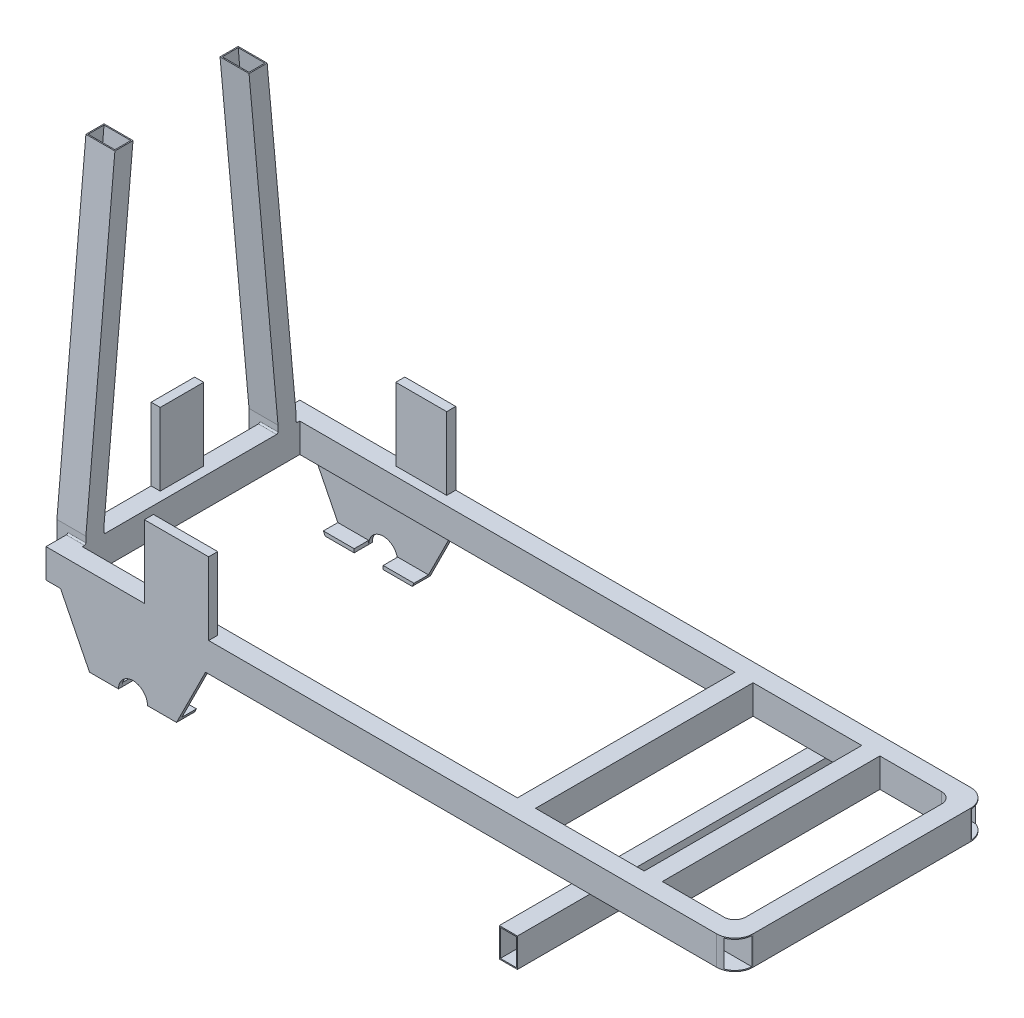
from build123d import *

# Parameters (mm, degrees)
SKETCH1_W            = 25
SKETCH1_H            = 40
SKETCH1_W_2          = 22
SKETCH1_H_2          = 37
BOSS_EXTRUDE1_DEPTH  = 950
SKETCH3_W            = 25
SKETCH3_H            = 40
SKETCH3_W_2          = 22
SKETCH3_H_2          = 37
BOSS_EXTRUDE2_DEPTH  = 950
SKETCH4_W            = 25
SKETCH4_H            = 40
SKETCH4_W_2          = 22
SKETCH4_H_2          = 37
BOSS_EXTRUDE3_DEPTH  = 300
SKETCH5_W            = 25
SKETCH5_H            = 40
SKETCH5_W_2          = 22
SKETCH5_H_2          = 37
BOSS_EXTRUDE4_DEPTH  = 300
CUT_EXTRUDE1_DEPTH   = 300
CUT_EXTRUDE2_DEPTH   = 300
BOSS_EXTRUDE5_DEPTH  = 40
BOSS_EXTRUDE6_DEPTH  = 40
SKETCH10_W           = 25
SKETCH10_H           = 300
BOSS_EXTRUDE7_DEPTH  = 40
SKETCH12_W           = 25
SKETCH12_H           = 40
SKETCH12_W_2         = 22
SKETCH12_H_2         = 37
BOSS_EXTRUDE8_DEPTH  = 100
SKETCH14_W           = 25
SKETCH14_H           = 40
SKETCH14_W_2         = 22
SKETCH14_H_2         = 37
BOSS_EXTRUDE9_DEPTH  = 350
SKETCH15_W           = 25
SKETCH15_H           = 40
SKETCH15_W_2         = 22
SKETCH15_H_2         = 37
BOSS_EXTRUDE10_DEPTH = 300
BOSS_EXTRUDE11_DEPTH = 5
BOSS_EXTRUDE12_DEPTH = 20
SKETCH19_R           = 20
CUT_EXTRUDE3_DEPTH   = 20
SKETCH21_W           = 12.5
SKETCH21_H           = 60.024303072
SKETCH21_W_2         = 70.240967534
SKETCH21_H_2         = 12.5
SKETCH21_W_3         = 88.627521068
BOSS_EXTRUDE13_DEPTH = 100
BOSS_EXTRUDE14_DEPTH = 10
FILLET1_R            = 2
FILLET2_R            = 2
FILLET3_R            = 2
FILLET4_R            = 2
BOSS_EXTRUDE15_DEPTH = 40
BOSS_EXTRUDE16_DEPTH = 40
SWEEP1_START         = -14.984844988
SWEEP1_DEPTH         = 39.984844988
SWEEP1_2_DEPTH       = 1.5
SWEEP1_START_2       = 23.5
SWEEP1_3_DEPTH       = 1.5
SWEEP2_START         = -14.984844988
SWEEP2_DEPTH         = 39.984844988
SWEEP2_2_DEPTH       = 1.5
SWEEP2_START_2       = 23.5
SWEEP2_3_DEPTH       = 1.5


# Read off the part's stored shape, not the designer's step: Sweep1, Sweep2
with BuildPart() as part:
    # Sketch1 → Boss-Extrude1 (new body)
    with BuildSketch(Plane(origin=(0, 0, 0), x_dir=(0, 0, -1), z_dir=(1, 0, 0))):
        with Locations((12.5, -20)):
            Rectangle(SKETCH1_W, SKETCH1_H)
        with Locations((12.5, -20)):
            Rectangle(SKETCH1_W_2, SKETCH1_H_2, mode=Mode.SUBTRACT)
    extrude(amount=BOSS_EXTRUDE1_DEPTH)



with BuildPart() as body_2:
    # Sketch3 → Boss-Extrude2 (new body)
    with BuildSketch(Plane(origin=(950, 0, 0), x_dir=(0, 0, -1), z_dir=(1, 0, 0))):
        with Locations((337.5, -20)):
            Rectangle(SKETCH3_W, SKETCH3_H)
        with Locations((337.5, -20)):
            Rectangle(SKETCH3_W_2, SKETCH3_H_2, mode=Mode.SUBTRACT)
    extrude(amount=-BOSS_EXTRUDE2_DEPTH)


with BuildPart() as part_1:
    add(part.part)

    add(body_2.part)  # Boss-Extrude3 merges body 2
    # Sketch4 → Boss-Extrude3 (add)
    with BuildSketch(Plane.XY.offset(-325)):
        with Locations((937.5, -20)):
            Rectangle(SKETCH4_W, SKETCH4_H)
        with Locations((937.5, -20)):
            Rectangle(SKETCH4_W_2, SKETCH4_H_2, mode=Mode.SUBTRACT)
    extrude(amount=BOSS_EXTRUDE3_DEPTH)

    # Sketch5 → Boss-Extrude4 (add)
    with BuildSketch(Plane.XY.offset(-325)):
        with Locations((12.5, -20)):
            Rectangle(SKETCH5_W, SKETCH5_H)
        with Locations((12.5, -20)):
            Rectangle(SKETCH5_W_2, SKETCH5_H_2, mode=Mode.SUBTRACT)
    extrude(amount=BOSS_EXTRUDE4_DEPTH)

    # Sketch6 → Cut-Extrude1 (cut)
    with BuildSketch(Plane(origin=(0, 0, 0), x_dir=(1, 0, 0), z_dir=(0, 1, 0))):
        with BuildLine():
            Line((925, 0), (950, 0))
            Line((950, 0), (950, 25))
            ThreePointArc((950, 25), (942.67766953, 7.32233047), (925, 0))
        make_face()
    extrude(amount=-CUT_EXTRUDE1_DEPTH, mode=Mode.SUBTRACT)

    # Sketch7 → Cut-Extrude2 (cut)
    with BuildSketch(Plane(origin=(0, 0, 0), x_dir=(1, 0, 0), z_dir=(0, 1, 0))):
        with BuildLine():
            Line((950, 325), (950, 350))
            Line((950, 350), (925, 350))
            ThreePointArc((925, 350), (942.67766953, 342.67766953), (950, 325))
        make_face()
    extrude(amount=-CUT_EXTRUDE2_DEPTH, mode=Mode.SUBTRACT)

    # Sketch8 → Boss-Extrude5 (add)
    with BuildSketch(Plane(origin=(0, 0, 0), x_dir=(1, 0, 0), z_dir=(0, 1, 0))):
        with BuildLine():
            Line((910, 25), (925, 25))
            Line((925, 25), (925, 40))
            ThreePointArc((925, 40), (920.606601718, 29.393398282), (910, 25))
        make_face()
    extrude(amount=-BOSS_EXTRUDE5_DEPTH)

    # Sketch9 → Boss-Extrude6 (add)
    with BuildSketch(Plane(origin=(0, 0, 0), x_dir=(1, 0, 0), z_dir=(0, 1, 0))):
        with BuildLine():
            Line((925, 310), (925, 325))
            Line((925, 325), (910, 325))
            ThreePointArc((910, 325), (920.606601718, 320.606601718), (925, 310))
        make_face()
    extrude(amount=-BOSS_EXTRUDE6_DEPTH)

    # Sketch10 → Boss-Extrude7 (add)
    with BuildSketch(Plane(origin=(0, 0, 0), x_dir=(1, 0, 0), z_dir=(0, 1, 0))):
        with Locations((812.5, 175)):
            Rectangle(SKETCH10_W, SKETCH10_H)
    extrude(amount=-BOSS_EXTRUDE7_DEPTH)



with BuildPart() as body_2_2:
    # Sketch12 → Boss-Extrude8 (new body)
    with BuildSketch(Plane.XY):
        with Locations((737.631643114, -60)):
            Rectangle(SKETCH12_W, SKETCH12_H)
        with Locations((737.631643114, -60)):
            Rectangle(SKETCH12_W_2, SKETCH12_H_2, mode=Mode.SUBTRACT)
    extrude(amount=BOSS_EXTRUDE8_DEPTH)


with BuildPart() as part_2:
    add(part_1.part)

    add(body_2_2.part)  # Boss-Extrude9 merges body 2 2
    # Sketch14 → Boss-Extrude9 (add)
    with BuildSketch(Plane(origin=(0, 0, 0), x_dir=(-1, 0, 0), z_dir=(0, 0, -1))):
        with Locations((-737.631643114, -60)):
            Rectangle(SKETCH14_W, SKETCH14_H)
        with Locations((-737.631643114, -60)):
            Rectangle(SKETCH14_W_2, SKETCH14_H_2, mode=Mode.SUBTRACT)
    extrude(amount=BOSS_EXTRUDE9_DEPTH)

    # Sketch15 → Boss-Extrude10 (add)
    with BuildSketch(Plane.XY.offset(-325)):
        with Locations((637.631643114, -20)):
            Rectangle(SKETCH15_W, SKETCH15_H)
        with Locations((637.631643114, -20)):
            Rectangle(SKETCH15_W_2, SKETCH15_H_2, mode=Mode.SUBTRACT)
    extrude(amount=BOSS_EXTRUDE10_DEPTH)

    # Sketch16 → Boss-Extrude11 (add)
    with BuildSketch(Plane(origin=(0, 0, -350), x_dir=(-1, 0, 0), z_dir=(0, 0, -1))):
        Polygon((-20, -40), (-220, -40), (-180, -120), (-60, -120), align=None)
    boss_extrude11 = extrude(amount=-BOSS_EXTRUDE11_DEPTH)

    # Mirror1: Boss-Extrude11 across plane
    add(boss_extrude11.mirror(Plane.XY.offset(-175)))

    # Sketch18 → Boss-Extrude12 (add)
    with BuildSketch(Plane.XY.offset(-345)):
        Polygon((60, -115), (57.5, -115), (60, -120), (100, -120), (100, -115), align=None)
        Polygon((180, -115), (182.5, -115), (180, -120), (140, -120), (140, -115), align=None)
    boss_extrude12 = extrude(amount=BOSS_EXTRUDE12_DEPTH)

    # Sketch19 → Cut-Extrude3 (cut)
    with BuildSketch(Plane.XY.offset(-345)):
        with Locations((120, -120)):
            Circle(SKETCH19_R)
    cut_extrude3 = extrude(amount=-CUT_EXTRUDE3_DEPTH, mode=Mode.SUBTRACT)

    # Mirror2: Boss-Extrude12, Cut-Extrude3 across plane
    add(boss_extrude12.mirror(Plane.XY.offset(-175)))
    add(cut_extrude3.mirror(Plane.XY.offset(-175)), mode=Mode.SUBTRACT)

    # Sketch21 → Boss-Extrude13 (add)
    with BuildSketch(Plane(origin=(0, 0, 0), x_dir=(1, 0, 0), z_dir=(0, 1, 0))):
        with Locations((6.25, 175)):
            Rectangle(SKETCH21_W, SKETCH21_H)
        with Locations((180, 343.75)):
            Rectangle(SKETCH21_W_2, SKETCH21_H_2)
        with Locations((180, 6.25)):
            Rectangle(SKETCH21_W_3, SKETCH21_H_2)
    extrude(amount=BOSS_EXTRUDE13_DEPTH)

    # Sketch22 → Boss-Extrude14 (add)
    with BuildSketch(Plane(origin=(0, 0, 0), x_dir=(1, 0, 0), z_dir=(0, 1, 0))):
        Polygon((0, 320), (25, 320), (25, 295), (0, 295), (-14.984844988, 295), (-14.984844988, 320), align=None)
        Polygon((0, 318.5), (-13.484844988, 318.5), (-13.484844988, 296.5), (0, 296.5), (23.5, 296.5), (23.5, 318.5), align=None, mode=Mode.SUBTRACT)
    boss_extrude14 = extrude(amount=BOSS_EXTRUDE14_DEPTH)

    # Mirror3: Boss-Extrude14 across plane
    add(boss_extrude14.mirror(Plane.XY.offset(-175)))

    # Fillet1
    fillet1_edges = [part_2.edges().sort_by_distance(p)[0] for p in [
        (12.5, 0, -55),
    ]]
    fillet(fillet1_edges, radius=FILLET1_R)

    # Fillet2
    fillet2_edges = [part_2.edges().sort_by_distance(p)[0] for p in [
        (12.5, 0, -295),
    ]]
    fillet(fillet2_edges, radius=FILLET2_R)

    # Fillet3
    fillet3_edges = [part_2.edges().sort_by_distance(p)[0] for p in [
        (12.5, 0, -320),
    ]]
    fillet(fillet3_edges, radius=FILLET3_R)

    # Fillet4
    fillet4_edges = [part_2.edges().sort_by_distance(p)[0] for p in [
        (12.5, 0, -30),
    ]]
    fillet(fillet4_edges, radius=FILLET4_R)

    # Sketch23 → Boss-Extrude15 (add)
    with BuildSketch(Plane.XZ):
        Polygon((0, -31.5), (0, -30), (-14.984844988, -30), (-14.984844988, -55), (0, -55), (0, -53.5), (-13.484844988, -53.5), (-13.484844988, -31.5), align=None)
    extrude(amount=BOSS_EXTRUDE15_DEPTH)

    # Sketch24 → Boss-Extrude16 (add)
    with BuildSketch(Plane.XZ):
        Polygon((0, -296.5), (0, -295), (-14.984844988, -295), (-14.984844988, -320), (0, -320), (0, -318.5), (-13.484844988, -318.5), (-13.484844988, -296.5), align=None)
    extrude(amount=BOSS_EXTRUDE16_DEPTH)

    # Sweep1 outline → Sweep1 (add)
    with BuildSketch(Plane.YZ.offset(SWEEP1_START)):
        Polygon((10, -318.5), (10, -320), (450, -280), (450, -278.5), align=None)
        Polygon((10, -295), (10, -296.5), (450, -256.5), (450, -255), align=None)
    extrude(amount=SWEEP1_DEPTH)

    # Sweep1 2 outline → Sweep1 2 (add)
    with BuildSketch(Plane.YZ.offset(SWEEP1_START)):
        Polygon((10, -296.5), (10, -318.5), (450, -278.5), (450, -256.5), align=None)
    extrude(amount=SWEEP1_2_DEPTH)

    # Sweep1 3 outline → Sweep1 3 (add)
    with BuildSketch(Plane.YZ.offset(SWEEP1_START_2)):
        Polygon((10, -296.5), (10, -318.5), (450, -278.5), (450, -256.5), align=None)
    extrude(amount=SWEEP1_3_DEPTH)

    # Sweep2 outline → Sweep2 (add)
    with BuildSketch(Plane.YZ.offset(SWEEP2_START)):
        Polygon((10, -55), (450, -95), (450, -93.5), (10, -53.5), align=None)
        Polygon((10, -31.5), (450, -71.5), (450, -70), (10, -30), align=None)
    extrude(amount=SWEEP2_DEPTH)

    # Sweep2 2 outline → Sweep2 2 (add)
    with BuildSketch(Plane.YZ.offset(SWEEP2_START)):
        Polygon((10, -53.5), (450, -93.5), (450, -71.5), (10, -31.5), align=None)
    extrude(amount=SWEEP2_2_DEPTH)

    # Sweep2 3 outline → Sweep2 3 (add)
    with BuildSketch(Plane.YZ.offset(SWEEP2_START_2)):
        Polygon((10, -53.5), (450, -93.5), (450, -71.5), (10, -31.5), align=None)
    extrude(amount=SWEEP2_3_DEPTH)


solid = part_2.part
